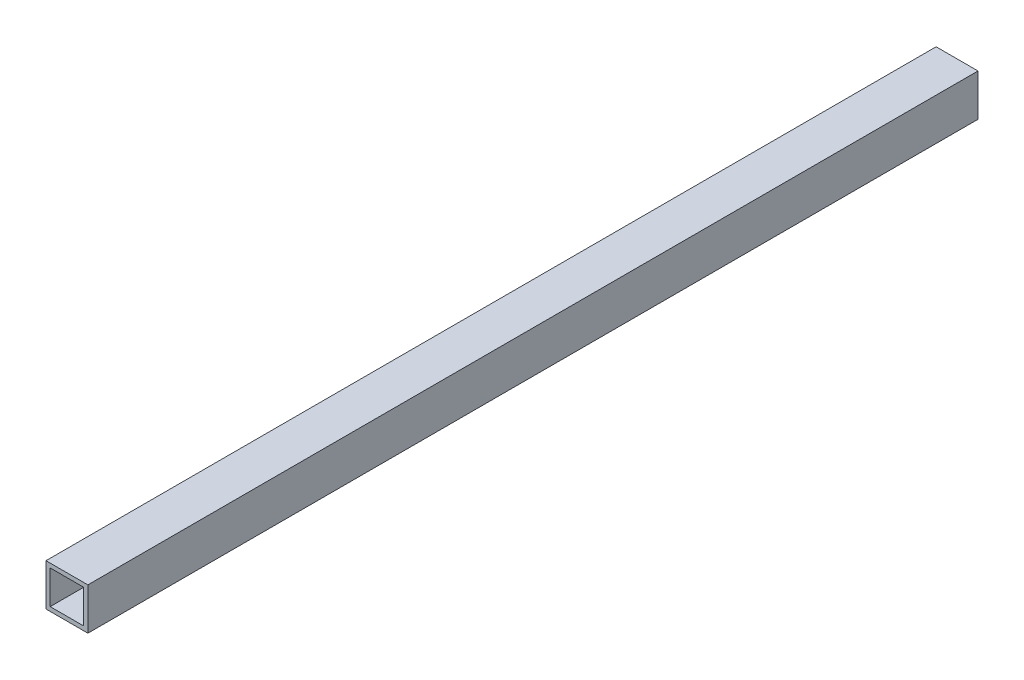
from build123d import *

# Parameters (mm, degrees)
SKETCH1_W           = 25.4
SKETCH1_H           = 25.4
SKETCH1_W_2         = 20.32
SKETCH1_H_2         = 20.32
BOSS_EXTRUDE1_DEPTH = 269.875


with BuildPart() as part:
    # Sketch1 → Boss-Extrude1 (new, symmetric)
    with BuildSketch(Plane.XY):
        Rectangle(SKETCH1_W, SKETCH1_H)
        Rectangle(SKETCH1_W_2, SKETCH1_H_2, mode=Mode.SUBTRACT)
    extrude(amount=BOSS_EXTRUDE1_DEPTH, both=True)


solid = part.part
